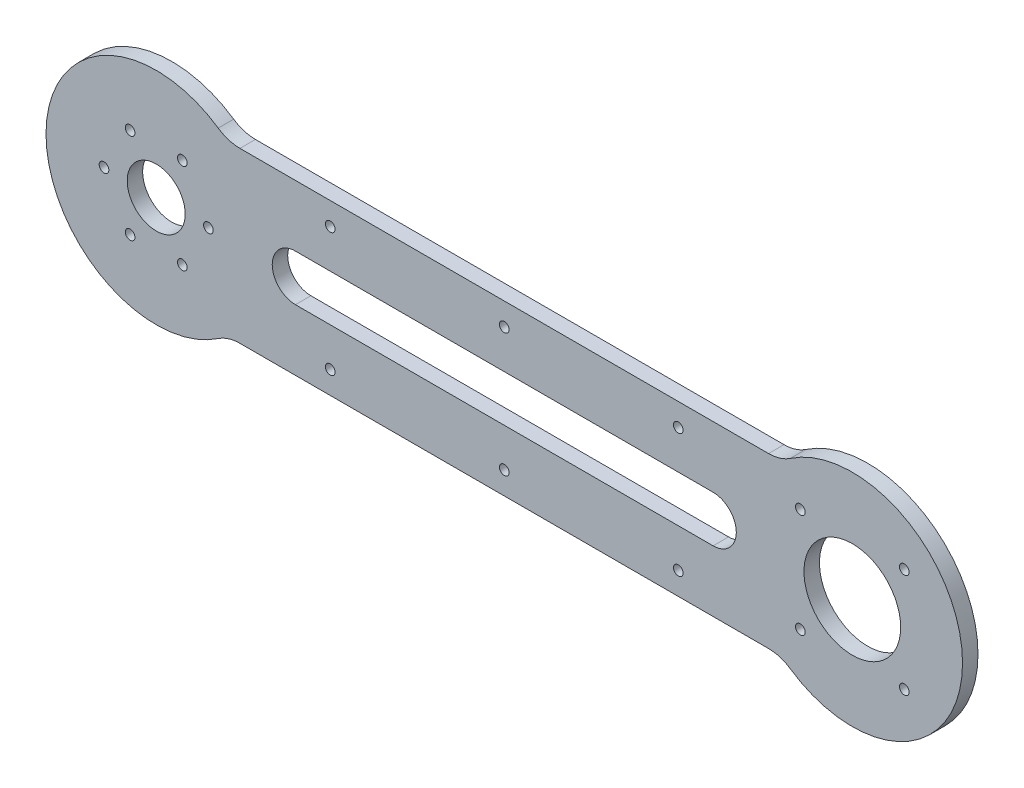
from build123d import *

# Parameters (mm, degrees)
EXTRUDE_1_DEPTH          = 4
FILLET_1_R               = 10
SKETCH_2_R               = 7.5
SKETCH_2_R_2             = 1.25
CUT_EXTRUDE_1_DEPTH      = 5
PATTERN_CIRCULAR_1_COUNT = 6
SKETCH_3_R               = 12.5
SKETCH_3_R_2             = 1.25
CUT_EXTRUDE_2_DEPTH      = 5
PATTERN_CIRCULAR_2_COUNT = 4
SKETCH_4_W               = 120
SKETCH_4_H               = 12
CUT_EXTRUDE_3_DEPTH      = 5
FILLET_2_R               = 6
FILLET_3_R               = 6
SKETCH_5_R               = 1.25
CUT_EXTRUDE_5_DEPTH      = 5
PATTERN_LINEAR_2_COUNT   = 3
PATTERN_LINEAR_2_PITCH   = 45


with BuildPart() as part:
    # 草图1 → 凸台-拉伸1 (new body)
    with BuildSketch(Plane.XY):
        with BuildLine():
            Line((18.319446876, 21.832266629), (161.680553124, 21.832266629))
            ThreePointArc((161.680553124, 21.832266629), (208.5, 0), (161.680553124, -21.832266629))
            Line((161.680553124, -21.832266629), (18.319446876, -21.832266629))
            ThreePointArc((18.319446876, -21.832266629), (-28.5, 0), (18.319446876, 21.832266629))
        make_face()
    extrude(amount=EXTRUDE_1_DEPTH)

    # 圆角1
    fillet_1_edges = [part.edges().sort_by_distance(p)[0] for p in [
        (18.319446876, 21.832266629, 2),
        (161.680553124, 21.832266629, 2),
        (161.680553124, -21.832266629, 2),
        (18.319446876, -21.832266629, 2),
    ]]
    fillet(fillet_1_edges, radius=FILLET_1_R)

    # 草图2 → 切除-拉伸1 (cut)
    with BuildSketch(Plane.XY.offset(4)):
        Circle(SKETCH_2_R)
        with Locations((-13.5, 0)):
            Circle(SKETCH_2_R_2)
    cut_extrude_1 = extrude(amount=-CUT_EXTRUDE_1_DEPTH, mode=Mode.SUBTRACT)

    # 阵列(圆周)1: 切除-拉伸1 ×6 about axis
    pattern_circular_1_axis = Axis((0, 0, 0), (0, 0, 1))
    for i in range(1, PATTERN_CIRCULAR_1_COUNT):
        add(cut_extrude_1.rotate(pattern_circular_1_axis, i * 360 / PATTERN_CIRCULAR_1_COUNT), mode=Mode.SUBTRACT)

    # 草图3 → 切除-拉伸2 (cut)
    with BuildSketch(Plane.XY.offset(4)):
        with Locations((180, 0)):
            Circle(SKETCH_3_R)
        with Locations((193.435028843, 13.435028843)):
            Circle(SKETCH_3_R_2)
    cut_extrude_2 = extrude(amount=-CUT_EXTRUDE_2_DEPTH, mode=Mode.SUBTRACT)

    # 阵列(圆周)2: 切除-拉伸2 ×4 about axis
    pattern_circular_2_axis = Axis((180, 0, 0), (0, 0, 1))
    for i in range(1, PATTERN_CIRCULAR_2_COUNT):
        add(cut_extrude_2.rotate(pattern_circular_2_axis, i * 360 / PATTERN_CIRCULAR_2_COUNT), mode=Mode.SUBTRACT)

    # 草图4 → 切除-拉伸3 (cut)
    with BuildSketch(Plane.XY.offset(4)):
        with Locations((90, 0)):
            Rectangle(SKETCH_4_W, SKETCH_4_H)
    extrude(amount=-CUT_EXTRUDE_3_DEPTH, mode=Mode.SUBTRACT)

    # 圆角2
    fillet_2_edges = [part.edges().sort_by_distance(p)[0] for p in [
        (30, 6, 2),
        (30, -6, 2),
    ]]
    fillet(fillet_2_edges, radius=FILLET_2_R - 0.0001)  # a hair under: the kernel refuses the full size

    # 圆角3
    fillet_3_edges = [part.edges().sort_by_distance(p)[0] for p in [
        (150, 6, 2),
        (150, -6, 2),
    ]]
    fillet(fillet_3_edges, radius=FILLET_3_R - 0.0001)  # a hair under: the kernel refuses the full size

    # 草图5 → 切除-拉伸5 (cut)
    with BuildSketch(Plane.XY.offset(4)):
        with Locations((45, 16)):
            Circle(SKETCH_5_R)
        with Locations((45, -16)):
            Circle(SKETCH_5_R)
    cut_extrude_5 = extrude(amount=-CUT_EXTRUDE_5_DEPTH, mode=Mode.SUBTRACT)

    # 阵列(线性)2: 切除-拉伸5 ×3
    with Locations(*[(i * PATTERN_LINEAR_2_PITCH, 0, 0) for i in range(1, PATTERN_LINEAR_2_COUNT)]):
        add(cut_extrude_5, mode=Mode.SUBTRACT)


solid = part.part
